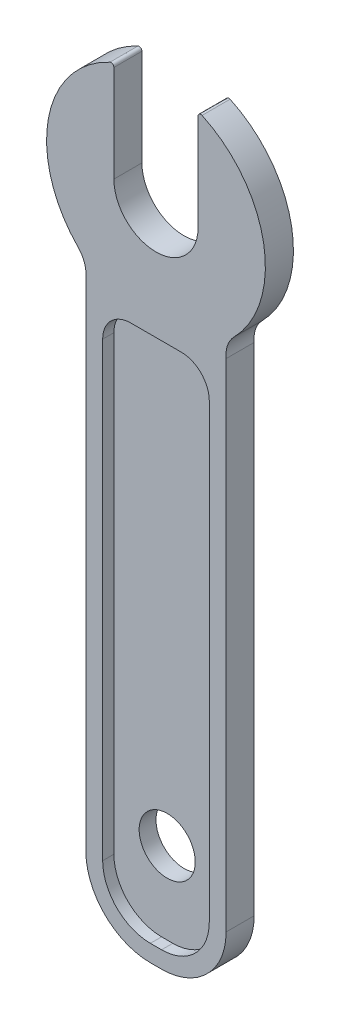
from build123d import *

# Parameters (mm, degrees)
SALIENTE_EXTRUIR1_DEPTH = 10
REDONDEO1_R             = 10
CORTAR_EXTRUIR1_DEPTH   = 4
CROQUIS4_R              = 10
CORTAR_EXTRUIR2_DEPTH   = 10


with BuildPart() as part:
    # Croquis1 → Saliente-Extruir1 (new body)
    with BuildSketch(Plane.XY):
        with BuildLine():
            Line((16.349667964, 100), (25, 100))
            Line((25, 100), (25, -77))
            ThreePointArc((25, -77), (18.263455967, -93.263455967), (2, -100))
            Line((2, -100), (-2, -100))
            ThreePointArc((-2, -100), (-18.263455967, -93.263455967), (-25, -77))
            Line((-25, -77), (-25, 100))
            Line((-25, 100), (-16.349667964, 100))
            ThreePointArc((-16.349667964, 100), (-38.999980166, 135.368129777), (-16.421052632, 170.781873976))
            ThreePointArc((-16.421052632, 170.781873976), (-15.461972413, 170.717764999), (-15, 169.874837769))
            Line((-15, 169.874837769), (-15, 135.40746189))
            ThreePointArc((-15, 135.40746189), (0, 120.40746189), (15, 135.40746189))
            Line((15, 135.40746189), (15, 169.874837769))
            ThreePointArc((15, 169.874837769), (15.461972413, 170.717764999), (16.421052632, 170.781873976))
            ThreePointArc((16.421052632, 170.781873976), (38.999980166, 135.368129777), (16.349667964, 100))
        make_face()
    extrude(amount=SALIENTE_EXTRUIR1_DEPTH)

    # Redondeo1
    # the kernel refuses this fillet: 10 mm, written as the material it adds along each edge
    with BuildSketch(Plane(origin=(-16.349667964, 100, 0), x_dir=(-1, 0, 0), z_dir=(0, 0, 1))) as redondeo1_piece_1:
        with BuildLine():
            CenterArc((18.594262382, -1.057473068), REDONDEO1_R, 173.929776198, 50.579134401)
            Line((11.462848025, -8.067674869), (11.320219738, -8.207878905))
            ThreePointArc((11.320219738, -8.207878905), (5.981746269, -3.678170401), (-0.083844451, -0.181576728))
            Line((-0.083844451, -0.181576728), (0, 0.2))
            ThreePointArc((0, 0.2), (4.325166018, 0.2), (8.451453429, 0.021149461))
            Line((8.451453429, 0.021149461), (8.650332036, 0))
        make_face()
    extrude(amount=10)
    with BuildSketch(Plane(origin=(16.349667964, 100, 0), x_dir=(0.8177652445483508, 0.5755519132178922, 0), z_dir=(0, 0, 1))) as redondeo1_piece_2:
        with BuildLine():
            CenterArc((15.814372171, -9.837198566), REDONDEO1_R, 100.352797219, 50.579134401)
            Line((7.073940893, -4.978715153), (6.899132268, -4.881545485))
            ThreePointArc((6.899132268, -4.881545485), (3.421860064, -2.652910626), (-0.115110383, -0.163553049))
            Line((-0.115110383, -0.163553049), (0.035941755, 0.196743971))
            ThreePointArc((0.035941755, 0.196743971), (7.008642212, -0.434925592), (13.98134267, 0.196743971))
            Line((13.98134267, 0.196743971), (14.017284425, 0))
        make_face()
    extrude(amount=10)

    # Croquis3 → Cortar-Extruir1 (cut)
    with BuildSketch(Plane.XY.offset(10)):
        with BuildLine():
            Line((-2, -94), (2, -94))
            ThreePointArc((2, -94), (14.02081528, -89.02081528), (19, -77))
            Line((19, -77), (19, 84))
            ThreePointArc((19, 84), (16.071067812, 91.071067812), (9, 94))
            Line((9, 94), (-9, 94))
            ThreePointArc((-9, 94), (-16.071067812, 91.071067812), (-19, 84))
            Line((-19, 84), (-19, -77))
            ThreePointArc((-19, -77), (-14.02081528, -89.02081528), (-2, -94))
        make_face()
    extrude(amount=-CORTAR_EXTRUIR1_DEPTH, mode=Mode.SUBTRACT)

    # Croquis4 → Cortar-Extruir2 (cut)
    with BuildSketch(Plane.XY.offset(6)):
        with Locations((0, -64.903172803)):
            Circle(CROQUIS4_R)
    extrude(amount=-CORTAR_EXTRUIR2_DEPTH, mode=Mode.SUBTRACT)


solid = part.part
